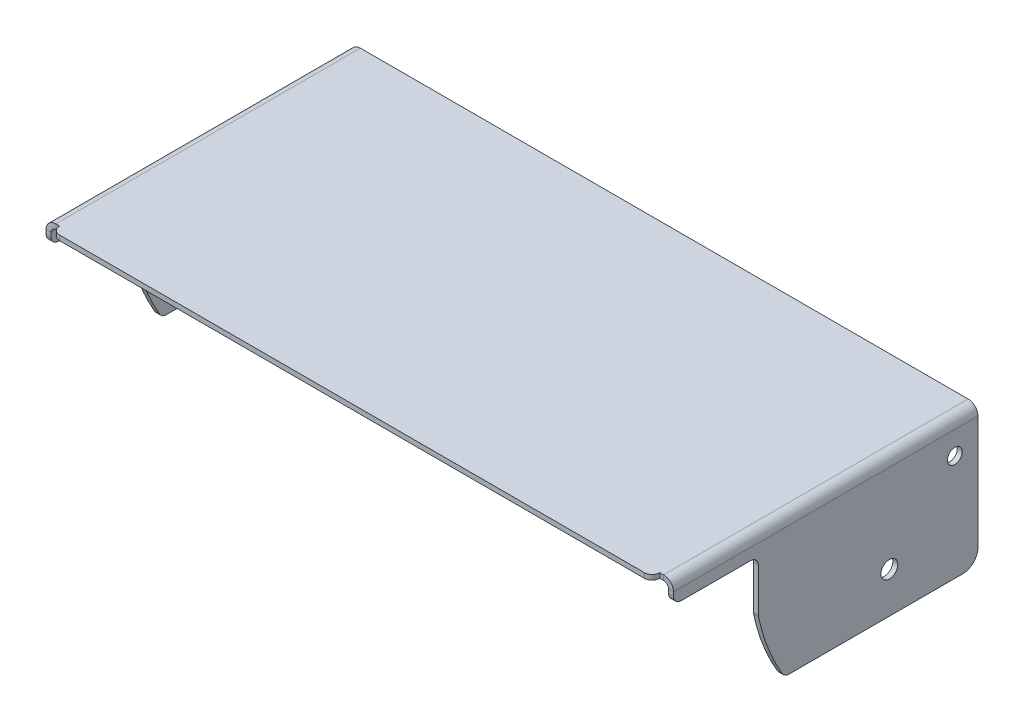
from build123d import *

# Parameters (mm, degrees)
SKETCH1_W                       = 129.159
SKETCH1_H                       = 1.016
BASE_FLANGE1_DEPTH              = 64.262
EDGE_FLANGE1_STRIP_W            = 6.096
EDGE_FLANGE1_STRIP_H            = 1.016
EDGE_FLANGE1_STRIP_CUT_DEPTH    = 62.6745
EDGE_FLANGE1_RELIEF_W           = 6.8834
EDGE_FLANGE1_RELIEF_H           = 1.6002
EDGE_FLANGE1_RELIEF_CUT_DEPTH   = 1.016
EDGE_FLANGE1_STRIP_2_W          = 6.096
EDGE_FLANGE1_STRIP_2_H          = 1.016
EDGE_FLANGE1_STRIP_CUT_2_DEPTH  = 62.6618
EDGE_FLANGE1_RELIEF_2_W         = 6.8834
EDGE_FLANGE1_RELIEF_2_H         = 1.6002
EDGE_FLANGE1_RELIEF_CUT_2_DEPTH = 1.016
EDGE_FLANGE1_DEPTH              = 62.6745
EDGE_FLANGE1_BEND_DEPTH         = 62.6618
BREAK_CORNER1_START             = -64.5795
BREAK_CORNER1_DEPTH             = 129.159
F_1_8_0_125_DIAMETER_HOLE1_D    = 3.048
BREAK_CORNER2_START             = -1.016
BREAK_CORNER2_DEPTH             = 1.016
F_1_8_0_125_DIAMETER_HOLE4_D    = 3.4798
SKETCH20_W                      = 17.4625
SKETCH20_H                      = 24.1808
CUT_EXTRUDE4_DEPTH              = 148.065232295
CUT_EXTRUDE5_DEPTH              = 148.065232295
FILLET3_R                       = 1.5875


# Read off the part's stored shape, not the designer's step: Break-Corner1, Break-Corner2
# Sheet-metal steps are written as plain solids
with BuildPart() as part:
    # Sketch1 → Base-Flange1 (new body)
    with BuildSketch(Plane.XY):
        with Locations((0, -0.508)):
            Rectangle(SKETCH1_W, SKETCH1_H)
    extrude(amount=BASE_FLANGE1_DEPTH)

    # Edge-Flange1 strip (across the edge) → Edge-Flange1 strip cut (cut)
    with BuildSketch(Plane(origin=(64.5795, -1.016, 0), x_dir=(-1, 0, 0), z_dir=(0, 0, 1))):
        with Locations((-1.016, -0.508)):
            Rectangle(EDGE_FLANGE1_STRIP_W, EDGE_FLANGE1_STRIP_H)
    extrude(amount=EDGE_FLANGE1_STRIP_CUT_DEPTH, mode=Mode.SUBTRACT)

    # Edge-Flange1 relief (on the sheet) → Edge-Flange1 relief cut (cut)
    with BuildSketch(Plane(origin=(62.5475, -1.016, 0), x_dir=(-1, 0, 0), z_dir=(0, -1, 0))):
        with Locations((-2.6543, -63.4746)):
            Rectangle(EDGE_FLANGE1_RELIEF_W, EDGE_FLANGE1_RELIEF_H)
    extrude(amount=-EDGE_FLANGE1_RELIEF_CUT_DEPTH, mode=Mode.SUBTRACT)

    # Edge-Flange1 strip 2 (across the edge) → Edge-Flange1 strip cut 2 (cut)
    with BuildSketch(Plane(origin=(-64.5795, -1.016, 62.6618), x_dir=(1, 0, 0), z_dir=(0, 0, -1))):
        with Locations((-1.016, -0.508)):
            Rectangle(EDGE_FLANGE1_STRIP_2_W, EDGE_FLANGE1_STRIP_2_H)
    extrude(amount=EDGE_FLANGE1_STRIP_CUT_2_DEPTH, mode=Mode.SUBTRACT)

    # Edge-Flange1 relief 2 (on the sheet) → Edge-Flange1 relief cut 2 (cut)
    with BuildSketch(Plane(origin=(-62.5475, -1.016, 62.6618), x_dir=(1, 0, 0), z_dir=(0, -1, 0))):
        with Locations((-2.6543, 0.8001)):
            Rectangle(EDGE_FLANGE1_RELIEF_2_W, EDGE_FLANGE1_RELIEF_2_H)
    extrude(amount=-EDGE_FLANGE1_RELIEF_CUT_2_DEPTH, mode=Mode.SUBTRACT)

    # Edge-Flange1 section (across the edge) → Edge-Flange1 (add)
    with BuildSketch(Plane(origin=(64.5795, -1.016, 0), x_dir=(-1, 0, 0), z_dir=(0, 0, 1))):
        with BuildLine():
            Line((0, 1.016), (0, 27.559))
            Line((0, 27.559), (1.016, 27.559))
            Line((1.016, 27.559), (1.016, 1.016))
            ThreePointArc((1.016, 1.016), (1.31357951, 0.29757951), (2.032, 0))
            Line((2.032, 0), (2.032, -1.016))
            ThreePointArc((2.032, -1.016), (0.595159021, -0.420840979), (0, 1.016))
        make_face()
    extrude(amount=EDGE_FLANGE1_DEPTH)

    # Edge-Flange1 section 2 (across the edge) → Edge-Flange1 bend (add)
    with BuildSketch(Plane(origin=(-64.5795, -1.016, 62.6618), x_dir=(1, 0, 0), z_dir=(0, 0, -1))):
        with BuildLine():
            Line((0, 1.016), (0, 27.559))
            Line((0, 27.559), (1.016, 27.559))
            Line((1.016, 27.559), (1.016, 1.016))
            ThreePointArc((1.016, 1.016), (1.31357951, 0.29757951), (2.032, 0))
            Line((2.032, 0), (2.032, -1.016))
            ThreePointArc((2.032, -1.016), (0.595159021, -0.420840979), (0, 1.016))
        make_face()
    extrude(amount=EDGE_FLANGE1_BEND_DEPTH)

    # Break-Corner1 outline → Break-Corner1 (cut)
    with BuildSketch(Plane.YZ.offset(BREAK_CORNER1_START)):
        with BuildLine():
            ThreePointArc((-25.4, 0), (-27.64506403, 0.92993597), (-28.575, 3.175))
            Line((-28.575, 3.175), (-28.575, 0))
            Line((-28.575, 0), (-25.4, 0))
        make_face()
    extrude(amount=BREAK_CORNER1_DEPTH, mode=Mode.SUBTRACT)

    # 1/8 (0.125) Diameter Hole1 (through all)
    with Locations(Plane(origin=(64.5795, 0, 0), x_dir=(0, 0, -1), z_dir=(1, 0, 0))):
        with Locations((-4.7752, -6.746875)):
            Hole(F_1_8_0_125_DIAMETER_HOLE1_D / 2)

    # Break-Corner2 outline → Break-Corner2 (cut)
    with BuildSketch(Plane(origin=(0, 0, 0), x_dir=(1, 0, 0), z_dir=(0, 1, 0)).offset(BREAK_CORNER2_START)):
        with BuildLine():
            Line((-61.7601, -64.262), (-60.1726, -64.262))
            ThreePointArc((-60.1726, -64.262), (-61.295132015, -63.797032015), (-61.7601, -62.6745))
            Line((-61.7601, -62.6745), (-61.7601, -64.262))
        make_face()
        with BuildLine():
            ThreePointArc((61.7601, -62.6745), (61.295132015, -63.797032015), (60.1726, -64.262))
            Line((60.1726, -64.262), (61.7601, -64.262))
            Line((61.7601, -64.262), (61.7601, -62.6745))
        make_face()
    extrude(amount=BREAK_CORNER2_DEPTH, mode=Mode.SUBTRACT)

    # 1/8 (0.125) Diameter Hole4 (through all)
    with Locations(Plane(origin=(64.5795, 0, 0), x_dir=(0, 0, -1), z_dir=(1, 0, 0))):
        with Locations((-18.245584182, -20.217259182)):
            Hole(F_1_8_0_125_DIAMETER_HOLE4_D / 2)

    # Sketch20 → Cut-Extrude4 (cut, through all)
    with BuildSketch(Plane(origin=(64.5795, 0, 0), x_dir=(0, 0, -1), z_dir=(1, 0, 0))):
        with Locations((-53.94325, -16.4846)):
            Rectangle(SKETCH20_W, SKETCH20_H)
    extrude(amount=-CUT_EXTRUDE4_DEPTH, mode=Mode.SUBTRACT)

    # Sketch21 → Cut-Extrude5 (cut, through all)
    with BuildSketch(Plane(origin=(64.5795, 0, 0), x_dir=(0, 0, -1), z_dir=(1, 0, 0))):
        with BuildLine():
            Line((-39.806023342, -28.575), (-45.212, -28.575))
            Line((-45.212, -28.575), (-45.212, -15.022793726))
            ThreePointArc((-45.212, -15.022793726), (-43.112598411, -22.039667684), (-39.806023342, -28.575))
        make_face()
    extrude(amount=-CUT_EXTRUDE5_DEPTH, mode=Mode.SUBTRACT)

    # Fillet3
    fillet3_edges = [part.edges().sort_by_distance(p)[0] for p in [
        (64.0715, -4.3942, 62.6745),
        (-64.0715, -4.3942, 62.6618),
        (64.0715, -4.3942, 45.212),
        (-64.0715, -4.3942, 45.212),
        (64.0715, -15.022793726, 45.212),
        (64.0715, -28.575, 39.806023342),
        (-64.0715, -15.022793726, 45.212),
        (-64.0715, -28.575, 39.806023342),
    ]]
    fillet(fillet3_edges, radius=FILLET3_R)


solid = part.part
